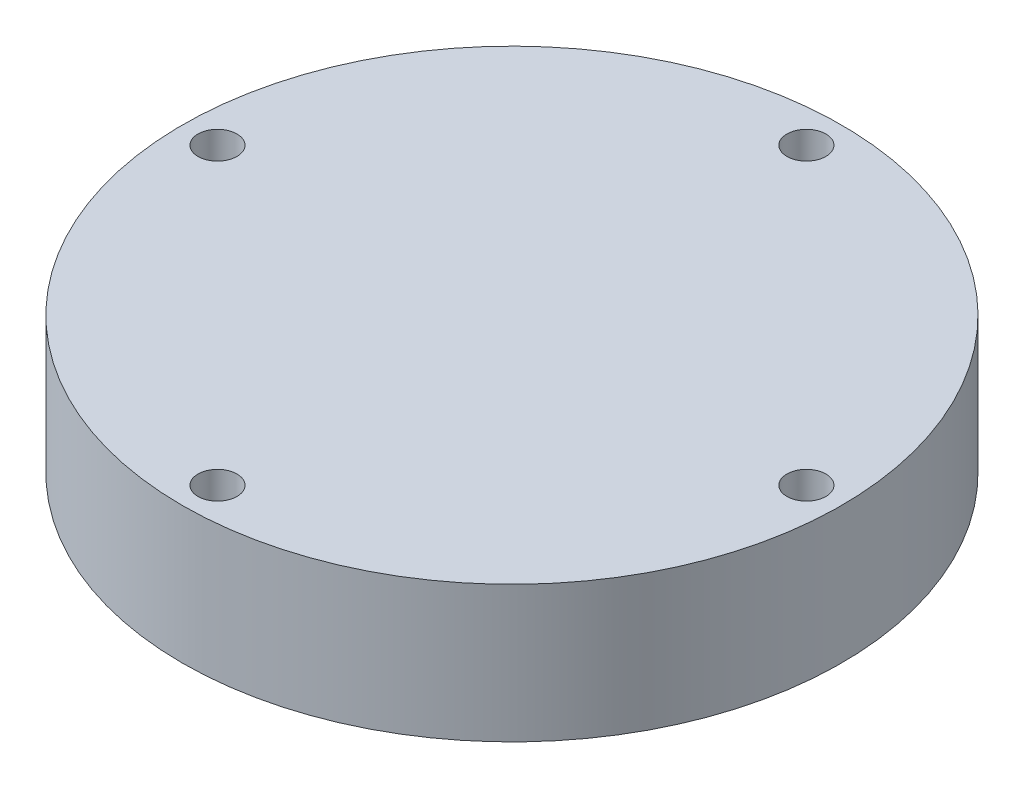
from build123d import *

# Parameters (mm, degrees)
SKETCH1_R           = 16.9
SKETCH1_R_2         = 1
BOSS_EXTRUDE1_DEPTH = 7
WRAP1_DEPTH         = 0.5


# Read off the part's stored shape, not the designer's step: Wrap1
with BuildPart() as part:
    # Sketch1 → Boss-Extrude1 (new body)
    with BuildSketch(Plane(origin=(0, 0, 0), x_dir=(1, 0, 0), z_dir=(0, 1, 0))):
        with Locations(Location((0, 0, 0), (0, 0, 270))):
            Circle(SKETCH1_R)
        with Locations(Location((0, 15.1, 0), (0, 0, 270))):
            Circle(SKETCH1_R_2, mode=Mode.SUBTRACT)
        with Locations(Location((15.1, 0, 0), (0, 0, 270))):
            Circle(SKETCH1_R_2, mode=Mode.SUBTRACT)
        with Locations(Location((0, -15.1, 0), (0, 0, 270))):
            Circle(SKETCH1_R_2, mode=Mode.SUBTRACT)
        with Locations(Location((-15.1, 0, 0), (0, 0, 270))):
            Circle(SKETCH1_R_2, mode=Mode.SUBTRACT)
    extrude(amount=BOSS_EXTRUDE1_DEPTH)

    # Wrap1 outline → Wrap1 (cut)
    # profile 1 of 12: a face of its own
    with BuildSketch(Plane(origin=(0, 0, 0), x_dir=(1, 0, 0), z_dir=(0, 1, 0))):
        with BuildLine():
            Line((-2.576923077, 7.687890169), (-3.263321314, 7.687890169))
            add(Edge.make_bspline(
                [(-3.263321314, 7.687890169), (-3.31053222, 7.687838273), (-3.400990413, 7.687738838), (-3.530705469, 7.684724092), (-3.6485152, 7.6806974), (-3.754165581, 7.675115507), (-3.847981679, 7.668518916), (-3.929538979, 7.659266877), (-3.999478535, 7.649606581), (-4.041384985, 7.639785175), (-4.060496795, 7.635306035)],
                knots=[0, 0, 0, 0, 0.176955752, 0.33905508, 0.486318225, 0.618780923, 0.735618828, 0.838742477, 0.926457068, 1, 1, 1, 1], degree=3))
            add(Edge.make_bspline(
                [(-4.060496795, 7.635306035), (-4.084690329, 7.628684085), (-4.132507306, 7.615596223), (-4.201408349, 7.5893825), (-4.266962194, 7.558300335), (-4.329393753, 7.522876395), (-4.387935836, 7.481590831), (-4.443461877, 7.436117213), (-4.495481857, 7.385405644), (-4.543703249, 7.330024904), (-4.587988047, 7.270904695), (-4.626117729, 7.207162465), (-4.658044956, 7.139871161), (-4.685428228, 7.06907759), (-4.705136682, 6.994187267), (-4.719983582, 6.915720554), (-4.72940721, 6.833685864), (-4.730309771, 6.777625997), (-4.730769231, 6.749088086)],
                knots=[0, 0, 0, 0, 0.062481339, 0.123490383, 0.183411094, 0.243153221, 0.302126735, 0.361709671, 0.421842292, 0.482931901, 0.544552254, 0.60568072, 0.667679738, 0.729984388, 0.794550921, 0.86034562, 0.928907356, 1, 1, 1, 1], degree=3))
            add(Edge.make_bspline(
                [(-4.730769231, 6.749088086), (-4.730347806, 6.720310309), (-4.72952326, 6.664004645), (-4.719626975, 6.581631857), (-4.706296783, 6.502913467), (-4.685799731, 6.428024017), (-4.658954058, 6.357408246), (-4.627462005, 6.289987014), (-4.589478475, 6.226907342), (-4.545833645, 6.167940225), (-4.49728205, 6.113030312), (-4.444029112, 6.062575518), (-4.38628982, 6.016871179), (-4.324247672, 5.975814836), (-4.257297823, 5.940358556), (-4.186455669, 5.908601251), (-4.111105453, 5.881930191), (-4.058962939, 5.867900129), (-4.032451923, 5.860766772)],
                knots=[0, 0, 0, 0, 0.070118894, 0.137192353, 0.202016181, 0.264631407, 0.326116547, 0.386010305, 0.445811847, 0.505297697, 0.564633278, 0.624282625, 0.683902032, 0.743952771, 0.805387731, 0.868388031, 0.933084028, 1, 1, 1, 1], degree=3))
            add(Edge.make_bspline(
                [(-4.032451923, 5.860766772), (-4.010524589, 5.856103791), (-3.962469562, 5.845884597), (-3.88332684, 5.83447614), (-3.791181454, 5.824738539), (-3.686159174, 5.817437402), (-3.568354269, 5.811187033), (-3.437703011, 5.806218939), (-3.293948934, 5.803489085), (-3.19367769, 5.803348293), (-3.141326122, 5.803274785)],
                knots=[0, 0, 0, 0, 0.075173117, 0.164746258, 0.268016881, 0.385911876, 0.517789479, 0.663690977, 0.824413221, 1, 1, 1, 1], degree=3))
            Line((-3.141326122, 5.803274785), (-2.891025641, 5.803274785))
            Line((-2.891025641, 5.803274785), (-2.891025641, 4.187890169))
            Line((-2.891025641, 4.187890169), (-2.576923077, 4.187890169))
            Line((-2.576923077, 4.187890169), (-2.576923077, 7.687890169))
        make_face()
        with BuildLine():
            Line((-2.891025641, 6.162249144), (-3.50380609, 6.154536804))
            add(Edge.make_bspline(
                [(-3.50380609, 6.154536804), (-3.533726016, 6.15452134), (-3.591485815, 6.154491488), (-3.674922039, 6.158476712), (-3.752331326, 6.163077244), (-3.823475901, 6.169813168), (-3.888387836, 6.179334425), (-3.947175365, 6.188946163), (-3.999382648, 6.202851526), (-4.060481849, 6.221574595), (-4.128565197, 6.253507211), (-4.202632745, 6.299857101), (-4.265403332, 6.358937809), (-4.319721629, 6.42536564), (-4.362827506, 6.49926477), (-4.394383499, 6.578333706), (-4.412924656, 6.661761556), (-4.41541085, 6.718849695), (-4.416666667, 6.747685843)],
                knots=[0, 0, 0, 0, 0.072538371, 0.140033831, 0.202495681, 0.260575056, 0.313228338, 0.361583194, 0.404878361, 0.444127437, 0.516399693, 0.586506671, 0.655085374, 0.724383783, 0.793973529, 0.861637682, 0.930110942, 1, 1, 1, 1], degree=3))
            add(Edge.make_bspline(
                [(-4.416666667, 6.747685843), (-4.41540402, 6.775824356), (-4.412894035, 6.831760238), (-4.394238172, 6.913738999), (-4.362888858, 6.991974703), (-4.319432264, 7.064947788), (-4.266691134, 7.131136592), (-4.205391791, 7.18863372), (-4.135678529, 7.234855422), (-4.070830298, 7.264688704), (-4.013229112, 7.282903979), (-3.963197152, 7.29564882), (-3.906706478, 7.305824426), (-3.843738698, 7.314063929), (-3.774781864, 7.32111739), (-3.69924355, 7.325903367), (-3.617409906, 7.328704824), (-3.560599335, 7.328843779), (-3.53114984, 7.32891581)],
                knots=[0, 0, 0, 0, 0.070043755, 0.139238317, 0.208197455, 0.279173374, 0.349986812, 0.418353846, 0.487609584, 0.557411073, 0.595330157, 0.637964052, 0.685912778, 0.738185165, 0.796102647, 0.858516544, 0.926657726, 1, 1, 1, 1], degree=3))
            Line((-3.53114984, 7.32891581), (-2.891025641, 7.32891581))
            Line((-2.891025641, 7.32891581), (-2.891025641, 6.162249144))
        make_face(mode=Mode.SUBTRACT)
    # profile 2 of 12: a face of its own
    with BuildSketch(Plane(origin=(0, 0, 0), x_dir=(1, 0, 0), z_dir=(0, 1, 0))):
        with BuildLine():
            add(Edge.make_bspline(
                [(0.003205128, 7.777633759), (-0.061602978, 7.77599228), (-0.188891445, 7.772768279), (-0.375966342, 7.748089175), (-0.554561438, 7.705393785), (-0.726131576, 7.648530803), (-0.888624553, 7.572676418), (-1.043263446, 7.480991269), (-1.189680319, 7.37251481), (-1.325901701, 7.248085584), (-1.450558651, 7.11270213), (-1.560384537, 6.96822422), (-1.652426831, 6.815525417), (-1.728012618, 6.655064587), (-1.787311228, 6.487204619), (-1.828230272, 6.311050616), (-1.854368422, 6.127743926), (-1.857424199, 6.002717061), (-1.858974359, 5.939292413)],
                knots=[0, 0, 0, 0, 0.066570035, 0.130749041, 0.1934128, 0.254989399, 0.316113556, 0.377261758, 0.439400784, 0.502970589, 0.566524976, 0.628231103, 0.689090611, 0.749344669, 0.810169593, 0.871609824, 0.934869184, 1, 1, 1, 1], degree=3))
            add(Edge.make_bspline(
                [(-1.858974359, 5.939292413), (-1.857424426, 5.876334967), (-1.85436933, 5.752238546), (-1.828200552, 5.570095102), (-1.787159552, 5.395004406), (-1.728563286, 5.227258753), (-1.653337808, 5.066681189), (-1.560682637, 4.913694235), (-1.451541426, 4.768247737), (-1.327334575, 4.631935072), (-1.191933533, 4.506937601), (-1.046703266, 4.398018725), (-0.894909946, 4.304294601), (-0.734600238, 4.229510927), (-0.567900201, 4.169739006), (-0.393317878, 4.128986376), (-0.211671324, 4.102699333), (-0.08780032, 4.099680817), (-0.024839744, 4.09814658)],
                knots=[0, 0, 0, 0, 0.065226504, 0.128568996, 0.190320378, 0.251377989, 0.312387528, 0.373788704, 0.43643116, 0.500566755, 0.564686795, 0.627135518, 0.688455409, 0.749245746, 0.810155177, 0.871670926, 0.934773496, 1, 1, 1, 1], degree=3))
            add(Edge.make_bspline(
                [(-0.024839744, 4.09814658), (0.038584575, 4.099695967), (0.163610791, 4.10275022), (0.347147827, 4.128931625), (0.523425571, 4.169872929), (0.691939922, 4.228382365), (0.852784851, 4.303999596), (1.006274934, 4.396203975), (1.151794081, 4.505611116), (1.288135828, 4.629777691), (1.412885026, 4.764949243), (1.521644402, 4.909783498), (1.613869515, 5.061438955), (1.689232847, 5.220336479), (1.748897307, 5.385707921), (1.789602125, 5.558656399), (1.815938077, 5.738195905), (1.818972924, 5.860438803), (1.820512821, 5.92246549)],
                knots=[0, 0, 0, 0, 0.065818877, 0.129746527, 0.192071954, 0.253459424, 0.314569588, 0.376279881, 0.439025654, 0.503267029, 0.567492823, 0.629704796, 0.690999649, 0.751451651, 0.812004364, 0.873149681, 0.935635484, 1, 1, 1, 1], degree=3))
            add(Edge.make_bspline(
                [(1.820512821, 5.92246549), (1.819978185, 5.964098159), (1.818915659, 6.046838283), (1.806123966, 6.169704883), (1.787562265, 6.290595541), (1.760960352, 6.409166488), (1.726168685, 6.525127473), (1.685116658, 6.639278236), (1.634976813, 6.75046196), (1.578296165, 6.859205351), (1.515034357, 6.963813257), (1.445158607, 7.06269284), (1.371123239, 7.156673837), (1.289959845, 7.243320841), (1.2043434, 7.325154497), (1.112885022, 7.400917215), (1.016142777, 7.471292165), (0.913700398, 7.534712507), (0.808082123, 7.592071641), (0.699205345, 7.641293492), (0.588548773, 7.683539554), (0.475594126, 7.717780379), (0.360641353, 7.744812415), (0.243439569, 7.763219769), (0.124082143, 7.776044086), (0.043670824, 7.777101588), (0.003205128, 7.777633759)],
                knots=[0, 0, 0, 0, 0.043208986, 0.085872872, 0.128120007, 0.170151964, 0.211917621, 0.253753003, 0.296006409, 0.338443357, 0.381015368, 0.422820479, 0.464089056, 0.505125849, 0.545974971, 0.586985211, 0.628338592, 0.670083802, 0.711991602, 0.753039155, 0.794049395, 0.834885543, 0.875498313, 0.9165473, 0.958003779, 1, 1, 1, 1], degree=3))
        make_face()
        with BuildLine():
            add(Edge.make_bspline(
                [(-0.012219551, 7.4186594), (0.020995082, 7.41825451), (0.087106815, 7.4174486), (0.185391351, 7.406832885), (0.282383285, 7.391702996), (0.378102647, 7.370121475), (0.472148937, 7.340717422), (0.565398778, 7.306876514), (0.657001832, 7.265655423), (0.74665569, 7.219082719), (0.833570765, 7.167533798), (0.915583466, 7.110562031), (0.99290611, 7.049503477), (1.065349377, 6.98421564), (1.132700549, 6.914366038), (1.196285251, 6.841013602), (1.253554832, 6.762061711), (1.306040409, 6.679651304), (1.353008249, 6.593889723), (1.394773604, 6.50567986), (1.428937613, 6.414302173), (1.456799989, 6.320748016), (1.4798998, 6.225165556), (1.494533724, 6.126829707), (1.505266084, 6.026234595), (1.506025929, 5.958252741), (1.506410256, 5.923867734)],
                knots=[0, 0, 0, 0, 0.042023329, 0.083644911, 0.124983795, 0.166247461, 0.207701556, 0.249631071, 0.29174177, 0.334742875, 0.377460169, 0.419556319, 0.461044176, 0.502096284, 0.542890714, 0.583800819, 0.624863583, 0.666224689, 0.707399186, 0.748556678, 0.789654591, 0.830739726, 0.872070142, 0.913993395, 0.95649813, 1, 1, 1, 1], degree=3))
            add(Edge.make_bspline(
                [(1.506410256, 5.923867734), (1.505135394, 5.873305513), (1.502627347, 5.773833982), (1.480669776, 5.628065839), (1.446847802, 5.487977552), (1.396990436, 5.354335643), (1.334639821, 5.22599136), (1.257612931, 5.104083255), (1.166353845, 4.988578381), (1.062690318, 4.880283112), (0.949367612, 4.781437308), (0.829034882, 4.694673899), (0.702981274, 4.621263649), (0.570878072, 4.561458577), (0.433430533, 4.514068839), (0.289752982, 4.481590208), (0.140802522, 4.460214753), (0.039271867, 4.458161997), (-0.012219551, 4.457120939)],
                knots=[0, 0, 0, 0, 0.064503999, 0.126899322, 0.18774654, 0.248149733, 0.308586065, 0.369583005, 0.431826965, 0.496179723, 0.560667855, 0.623504455, 0.685260411, 0.746536822, 0.808327352, 0.870486188, 0.934316883, 1, 1, 1, 1], degree=3))
            add(Edge.make_bspline(
                [(-0.012219551, 4.457120939), (-0.046829053, 4.457596443), (-0.115470089, 4.458539511), (-0.217565612, 4.468038188), (-0.317821823, 4.483270057), (-0.416098103, 4.505200713), (-0.512282915, 4.532647919), (-0.606777718, 4.565255647), (-0.698576008, 4.605936851), (-0.788835846, 4.650884803), (-0.875232088, 4.70212496), (-0.95770762, 4.75716311), (-1.0341836, 4.81813173), (-1.106572671, 4.882449543), (-1.17420036, 4.951413391), (-1.236609344, 5.024933613), (-1.293589476, 5.10347427), (-1.346055123, 5.185759676), (-1.392858386, 5.271755928), (-1.433637485, 5.360285606), (-1.468233601, 5.451130716), (-1.496162106, 5.544422287), (-1.518047567, 5.639983136), (-1.533127487, 5.737941214), (-1.543675926, 5.838100557), (-1.544471003, 5.905844413), (-1.544871795, 5.939993535)],
                knots=[0, 0, 0, 0, 0.043633218, 0.086537777, 0.129177336, 0.171436324, 0.213415895, 0.255265955, 0.297369481, 0.339940748, 0.382347459, 0.423952947, 0.464871163, 0.505572294, 0.546002577, 0.586567975, 0.627064799, 0.668270684, 0.709549225, 0.750428154, 0.791096194, 0.832027145, 0.873135955, 0.914610764, 0.956955986, 1, 1, 1, 1], degree=3))
            add(Edge.make_bspline(
                [(-1.544871795, 5.939993535), (-1.544470682, 5.973909039), (-1.543675, 6.041186689), (-1.533132526, 6.140647508), (-1.518031635, 6.237900719), (-1.496268927, 6.332564522), (-1.468218774, 6.424663047), (-1.433631443, 6.514109795), (-1.392846144, 6.60123799), (-1.346037919, 6.685832287), (-1.293422096, 6.767007025), (-1.235927853, 6.844609437), (-1.172562504, 6.917182179), (-1.10513648, 6.986516873), (-1.031965594, 7.051134762), (-0.9533813, 7.111057283), (-0.870337622, 7.167730557), (-0.782410387, 7.218856119), (-0.691666433, 7.266070352), (-0.598552475, 7.306521355), (-0.504123376, 7.340893474), (-0.408619263, 7.37021044), (-0.311236285, 7.39161847), (-0.212632456, 7.40684652), (-0.112944198, 7.417444905), (-0.045900978, 7.418253284), (-0.012219551, 7.4186594)],
                knots=[0, 0, 0, 0, 0.042915082, 0.085129971, 0.126473319, 0.167453038, 0.207976333, 0.248249378, 0.288749987, 0.329669857, 0.370537287, 0.411128564, 0.451818913, 0.492405877, 0.533485862, 0.575263062, 0.617440613, 0.660671688, 0.703940204, 0.746867522, 0.7890793, 0.831104042, 0.87323799, 0.91516577, 0.957380658, 1, 1, 1, 1], degree=3))
        make_face(mode=Mode.SUBTRACT)
    # profile 3 of 12: a face of its own
    with BuildSketch(Plane(origin=(0, 0, 0), x_dir=(1, 0, 0), z_dir=(0, 1, 0))):
        with BuildLine():
            ThreePointArc((-15.093956132, 0.999981736), (-14.1, 0), (-15.093956132, -0.999981736))
            ThreePointArc((-15.093956132, -0.999981736), (-14.087912264, 0), (-15.093956132, 0.999981736))
        make_face()
    # profile 4 of 12: a face of its own
    with BuildSketch(Plane(origin=(0, 0, 0), x_dir=(1, 0, 0), z_dir=(0, 1, 0))):
        with BuildLine():
            ThreePointArc((-0.999981736, -15.093956132), (0, -14.1), (0.999981736, -15.093956132))
            ThreePointArc((0.999981736, -15.093956132), (0, -14.087912264), (-0.999981736, -15.093956132))
        make_face()
    # profile 5 of 12: a face of its own
    with BuildSketch(Plane(origin=(0, 0, 0), x_dir=(1, 0, 0), z_dir=(0, 1, 0))):
        with BuildLine():
            ThreePointArc((15.093956132, -0.999981736), (14.1, 0), (15.093956132, 0.999981736))
            ThreePointArc((15.093956132, 0.999981736), (14.087912264, 0), (15.093956132, -0.999981736))
        make_face()
    # profile 6 of 12: a face of its own
    with BuildSketch(Plane(origin=(0, 0, 0), x_dir=(1, 0, 0), z_dir=(0, 1, 0))):
        with BuildLine():
            ThreePointArc((0.999981736, 15.093956132), (0, 14.1), (-0.999981736, 15.093956132))
            ThreePointArc((-0.999981736, 15.093956132), (0, 14.087912264), (0.999981736, 15.093956132))
        make_face()
    # profile 7 of 12: a face of its own
    with BuildSketch(Plane(origin=(0, 0, 0), x_dir=(1, 0, 0), z_dir=(0, 1, 0))):
        Polygon((2.942307692, 7.32891581), (2.942307692, 4.187890169), (3.256410256, 4.187890169), (3.256410256, 7.32891581), (4.019230769, 7.32891581), (4.019230769, 7.687890169), (2.179487179, 7.687890169), (2.179487179, 7.32891581), align=None)
    # profile 8 of 12: a face of its own
    with BuildSketch(Plane(origin=(0, 0, 0), x_dir=(1, 0, 0), z_dir=(0, 1, 0))):
        Polygon((0, 16.887912264), (-0.25, 16.454899562), (0.25, 16.454899562), align=None)
    # profile 9 of 12: a face of its own
    with BuildSketch(Plane(origin=(0, 0, 0), x_dir=(1, 0, 0), z_dir=(0, 1, 0))):
        Polygon((-12.309401077, 0), (-8.845299462, -2), (-8.845299462, 2), align=None)
    # profile 10 of 12: a face of its own
    with BuildSketch(Plane(origin=(0, 0, 0), x_dir=(1, 0, 0), z_dir=(0, 1, 0))):
        Polygon((0, -12.309401077), (2, -8.845299462), (-2, -8.845299462), align=None)
    # profile 11 of 12: a face of its own
    with BuildSketch(Plane(origin=(0, 0, 0), x_dir=(1, 0, 0), z_dir=(0, 1, 0))):
        Polygon((12.309401077, 0), (8.845299462, 2), (8.845299462, -2), align=None)
    # profile 12 of 12: a face of its own
    with BuildSketch(Plane(origin=(0, 0, 0), x_dir=(1, 0, 0), z_dir=(0, 1, 0))):
        Polygon((0, 12.309401077), (-2, 8.845299462), (2, 8.845299462), align=None)
    extrude(amount=WRAP1_DEPTH, mode=Mode.SUBTRACT)


solid = part.part
